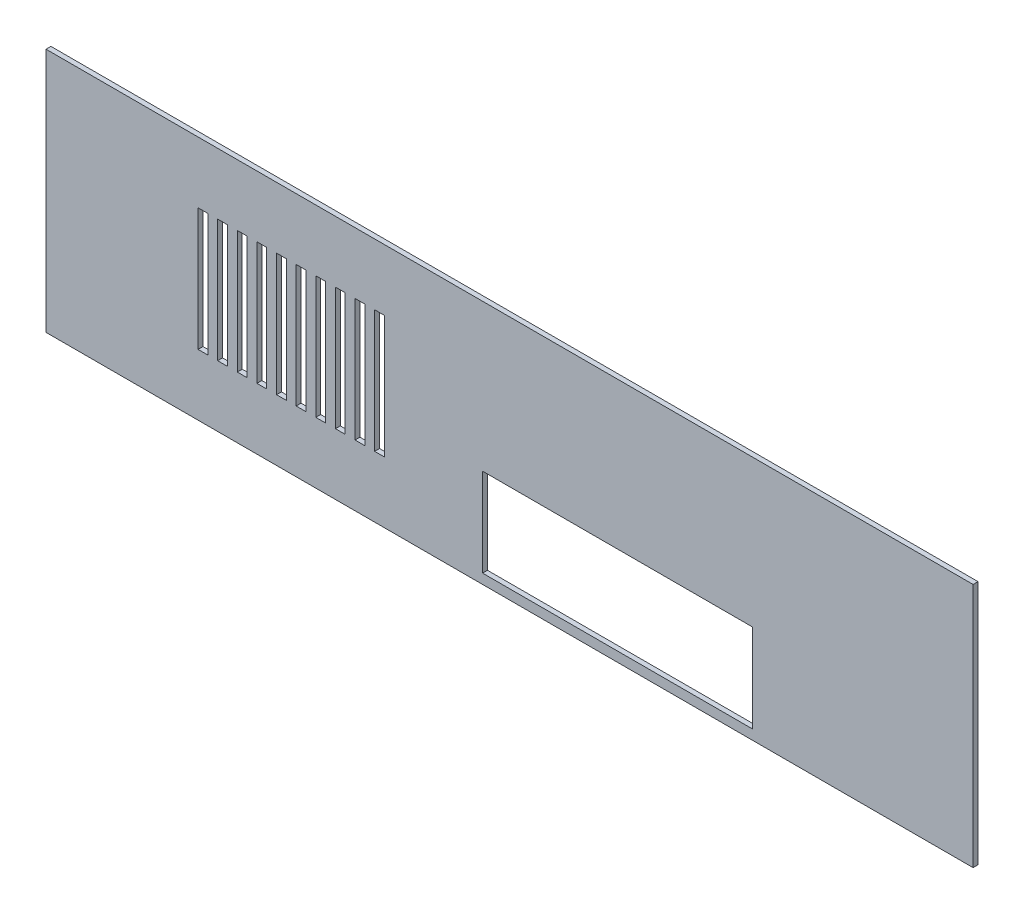
from build123d import *

# Parameters (mm, degrees)
SKETCH1_W           = 189
SKETCH1_H           = 50
BOSS_EXTRUDE1_DEPTH = 1
SKETCH2_W           = 55
SKETCH2_H           = 18
CUT_EXTRUDE1_DEPTH  = 134.866581758
SKETCH3_W           = 2
SKETCH3_H           = 25
CUT_EXTRUDE2_DEPTH  = 134.866581758


with BuildPart() as part:
    # Sketch1 → Boss-Extrude1 (new body)
    with BuildSketch(Plane.XY):
        with Locations((32.8655586, 16.198012015)):
            Rectangle(SKETCH1_W, SKETCH1_H)
    extrude(amount=BOSS_EXTRUDE1_DEPTH)

    # Sketch2 → Cut-Extrude1 (cut, through all)
    with BuildSketch(Plane.XY.offset(1)):
        with Locations((54.8655586, 2.198012015)):
            Rectangle(SKETCH2_W, SKETCH2_H)
    extrude(amount=-CUT_EXTRUDE1_DEPTH, mode=Mode.SUBTRACT)

    # Sketch3 → Cut-Extrude2 (cut, through all)
    with BuildSketch(Plane(origin=(0, 0, 0), x_dir=(-1, 0, 0), z_dir=(0, 0, -1))):
        with Locations((-6.3655586, 16.198012015)):
            Rectangle(SKETCH3_W, SKETCH3_H)
        with Locations((-2.3655586, 16.198012015)):
            Rectangle(SKETCH3_W, SKETCH3_H)
        with Locations((1.6344414, 16.198012015)):
            Rectangle(SKETCH3_W, SKETCH3_H)
        with Locations((5.6344414, 16.198012015)):
            Rectangle(SKETCH3_W, SKETCH3_H)
        with Locations((9.6344414, 16.198012015)):
            Rectangle(SKETCH3_W, SKETCH3_H)
        with Locations((13.6344414, 16.198012015)):
            Rectangle(SKETCH3_W, SKETCH3_H)
        with Locations((17.6344414, 16.198012015)):
            Rectangle(SKETCH3_W, SKETCH3_H)
        with Locations((21.6344414, 16.198012015)):
            Rectangle(SKETCH3_W, SKETCH3_H)
        with Locations((25.6344414, 16.198012015)):
            Rectangle(SKETCH3_W, SKETCH3_H)
        with Locations((29.6344414, 16.198012015)):
            Rectangle(SKETCH3_W, SKETCH3_H)
    extrude(amount=-CUT_EXTRUDE2_DEPTH, mode=Mode.SUBTRACT)


solid = part.part
